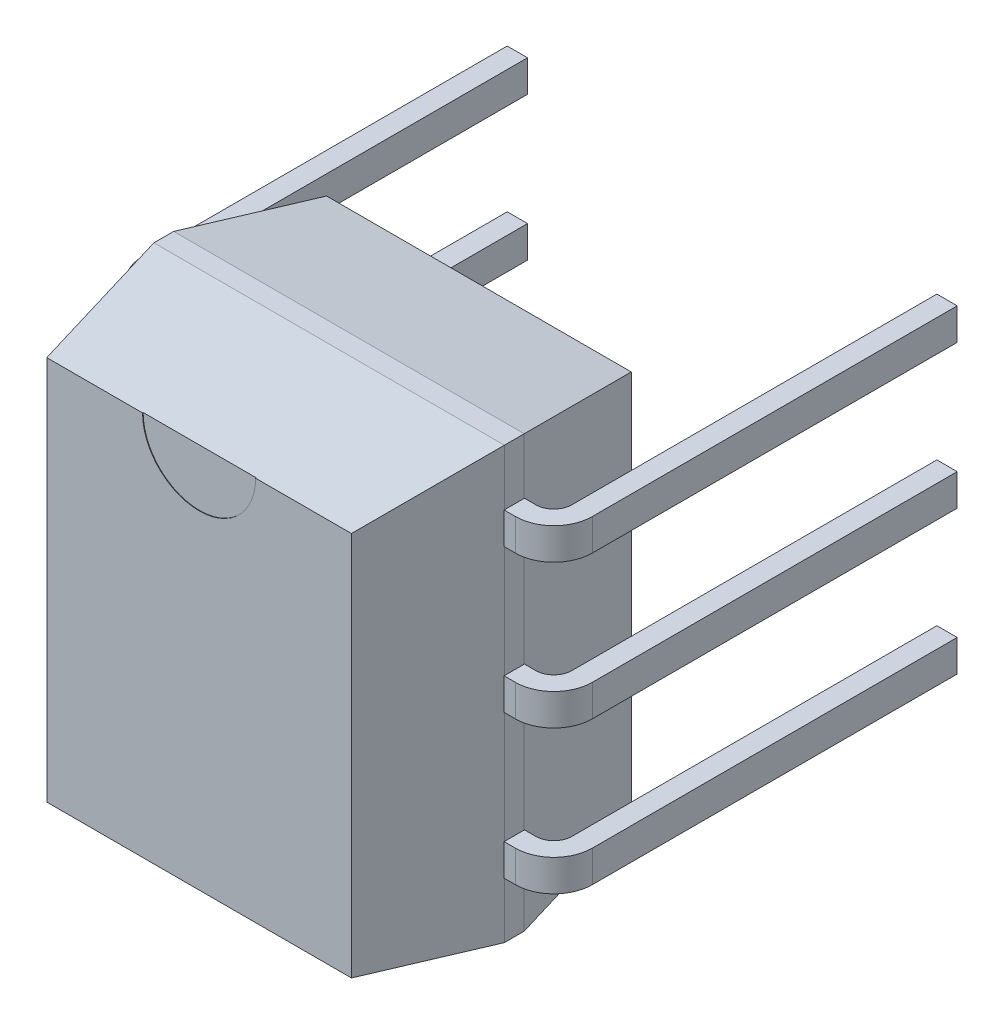
from build123d import *

# Parameters (mm, degrees)
EXTRUDE_1_DEPTH     = 4.95
SKETCH_5_W          = 0.36
SKETCH_5_H          = 0.56
SKETCH_5_2_W        = 0.36
SKETCH_5_2_H        = 0.56
EXTRUDE_2_DEPTH     = 4.1
CHAMFER_1_SIZE      = 2.3
CHAMFER_1_SIZE_2    = 0.405552056
SKETCH_6_R          = 1
CUT_EXTRUDE_1_DEPTH = 0.01
SKETCH_7_W          = 10.556189846
SKETCH_7_H          = 3.652287582
CUT_EXTRUDE_2_DEPTH = 20
CHAMFER_2_SIZE      = 2.3
CHAMFER_2_SIZE2     = 0.405552056
SKETCH_8_R          = 0.119462925
CUT_EXTRUDE_3_DEPTH = 2


with BuildPart() as part:
    # Эскиз3 → Вытянуть1 (new body)
    with BuildSketch(Plane.XY.offset(5.33)):
        Polygon((0.7, 1.27), (3.8, 1.27), (6.9, 1.27), (6.9, -8.89), (0.7, -8.89), align=None)
    extrude(amount=-EXTRUDE_1_DEPTH)

    # По траектории1: sweep along a path in Эскиз4
    with BuildLine(Plane(origin=(0, 0, 0), x_dir=(1, 0, 0), z_dir=(0, 1, 0))) as sweep_1_path:
        Line((0, 0), (0, -2.355))
        ThreePointArc((0, -2.355), (0.146446609, -2.708553391), (0.5, -2.855))
        Line((0.5, -2.855), (0.7, -2.855))
        Line((0.7, -2.855), (6.9, -2.855))
        Line((6.9, -2.855), (7.1, -2.855))
        ThreePointArc((7.1, -2.855), (7.453553391, -2.708553391), (7.6, -2.355))
        Line((7.6, -2.355), (7.6, 0))
        Line((7.6, 0), (7.6, 4.1))
    # Эскиз5 → По траектории1 (sweep)
    with BuildSketch(Plane.XY):
        with Locations((0, -2.54)):
            Rectangle(SKETCH_5_W, SKETCH_5_H)
        Rectangle(SKETCH_5_W, SKETCH_5_H)
        with Locations((0, -5.08)):
            Rectangle(SKETCH_5_W, SKETCH_5_H)
        with Locations((0, -7.62)):
            Rectangle(SKETCH_5_W, SKETCH_5_H)
    sweep(path=sweep_1_path.line)

    # Эскиз5<2> → Вытянуть2 (add)
    with BuildSketch(Plane.XY):
        with Locations((0, -2.54)):
            Rectangle(SKETCH_5_2_W, SKETCH_5_2_H)
        Rectangle(SKETCH_5_2_W, SKETCH_5_2_H)
        with Locations((0, -5.08)):
            Rectangle(SKETCH_5_2_W, SKETCH_5_2_H)
        with Locations((0, -7.62)):
            Rectangle(SKETCH_5_2_W, SKETCH_5_2_H)
    extrude(amount=-EXTRUDE_2_DEPTH)

    # Фаска1
    # the kernel refuses this chamfer: 2.3, 0.405552056 mm, written as the material it takes off along each edge
    with BuildSketch(Plane(origin=(12.876639232, -8.89, 0.38), x_dir=(0, -0.006682531656101655, 0.9999776716360548), z_dir=(-1, 0, 0))) as chamfer_1_piece_1:
        Polygon((CHAMFER_1_SIZE * 0.999977671636, CHAMFER_1_SIZE * 0.0066825316561), (-CHAMFER_1_SIZE_2 * 0.00668253165, CHAMFER_1_SIZE_2 * 0.999977670722), (0, 0), align=None)
    extrude(amount=18.153278464, mode=Mode.SUBTRACT)
    with BuildSketch(Plane(origin=(12.876639232, -8.89, 5.33), x_dir=(0, 0.9776715712462588, 0.2101387607674306), z_dir=(-1, 0, 0))) as chamfer_1_piece_2:
        Polygon((CHAMFER_1_SIZE_2 * 0.977671570353, CHAMFER_1_SIZE_2 * 0.210138760575), (-CHAMFER_1_SIZE * 0.210138760767, CHAMFER_1_SIZE * 0.977671571246), (0, 0), align=None)
    extrude(amount=18.153278464, mode=Mode.SUBTRACT)
    with BuildSketch(Plane(origin=(6.9, 7.246639232, 0.38), x_dir=(0.006682531656101655, 0, 0.9999776716360548), z_dir=(0, -1, 0))) as chamfer_1_piece_3_section:
        Polygon((CHAMFER_1_SIZE * 0.999977671636, CHAMFER_1_SIZE * 0.0066825316561), (-CHAMFER_1_SIZE_2 * 0.00668253165, CHAMFER_1_SIZE_2 * 0.999977670722), (0, 0), align=None)
    chamfer_1_piece_3 = extrude(amount=22.113278464, mode=Mode.PRIVATE)
    chamfer_1_piece_3 = split(chamfer_1_piece_3, bisect_by=Plane(origin=(6.899706122, 0.28, 2.676666667), z_dir=(0, 1, 0)), keep=Keep.TOP, mode=Mode.PRIVATE)
    add(chamfer_1_piece_3, mode=Mode.SUBTRACT)
    with BuildSketch(Plane(origin=(6.9, 7.246639232, 0.38), x_dir=(0.006682531656101655, 0, 0.9999776716360548), z_dir=(0, -1, 0))) as chamfer_1_piece_4_section:
        Polygon((CHAMFER_1_SIZE * 0.999977671636, CHAMFER_1_SIZE * 0.0066825316561), (-CHAMFER_1_SIZE_2 * 0.00668253165, CHAMFER_1_SIZE_2 * 0.999977670722), (0, 0), align=None)
    chamfer_1_piece_4 = extrude(amount=22.113278464, mode=Mode.PRIVATE)
    chamfer_1_piece_4 = split(chamfer_1_piece_4, bisect_by=Plane(origin=(6.764815344, 0, 2.675), z_dir=(0, 0, -1)), keep=Keep.TOP, mode=Mode.PRIVATE)
    add(chamfer_1_piece_4, mode=Mode.SUBTRACT)
    with BuildSketch(Plane(origin=(6.9, 7.246639232, 0.38), x_dir=(0.006682531656101655, 0, 0.9999776716360548), z_dir=(0, -1, 0))) as chamfer_1_piece_5_section:
        Polygon((CHAMFER_1_SIZE * 0.999977671636, CHAMFER_1_SIZE * 0.0066825316561), (-CHAMFER_1_SIZE_2 * 0.00668253165, CHAMFER_1_SIZE_2 * 0.999977670722), (0, 0), align=None)
    chamfer_1_piece_5 = extrude(amount=22.113278464, mode=Mode.PRIVATE)
    chamfer_1_piece_5 = split(chamfer_1_piece_5, bisect_by=Plane(origin=(6.899706122, -2.26, 2.676666667), z_dir=(0, 1, 0)), keep=Keep.TOP, mode=Mode.PRIVATE)
    chamfer_1_piece_5 = split(chamfer_1_piece_5, bisect_by=Plane(origin=(6.899706122, -0.28, 2.676666667), z_dir=(0, -1, 0)), keep=Keep.TOP, mode=Mode.PRIVATE)
    add(chamfer_1_piece_5, mode=Mode.SUBTRACT)
    with BuildSketch(Plane(origin=(6.9, 7.246639232, 0.38), x_dir=(0.006682531656101655, 0, 0.9999776716360548), z_dir=(0, -1, 0))) as chamfer_1_piece_6_section:
        Polygon((CHAMFER_1_SIZE * 0.999977671636, CHAMFER_1_SIZE * 0.0066825316561), (-CHAMFER_1_SIZE_2 * 0.00668253165, CHAMFER_1_SIZE_2 * 0.999977670722), (0, 0), align=None)
    chamfer_1_piece_6 = extrude(amount=22.113278464, mode=Mode.PRIVATE)
    chamfer_1_piece_6 = split(chamfer_1_piece_6, bisect_by=Plane(origin=(6.899706122, -2.82, 2.676666667), z_dir=(0, -1, 0)), keep=Keep.TOP, mode=Mode.PRIVATE)
    chamfer_1_piece_6 = split(chamfer_1_piece_6, bisect_by=Plane(origin=(6.899706122, -4.8, 2.676666667), z_dir=(0, 1, 0)), keep=Keep.TOP, mode=Mode.PRIVATE)
    add(chamfer_1_piece_6, mode=Mode.SUBTRACT)
    with BuildSketch(Plane(origin=(6.9, 7.246639232, 0.38), x_dir=(0.006682531656101655, 0, 0.9999776716360548), z_dir=(0, -1, 0))) as chamfer_1_piece_7_section:
        Polygon((CHAMFER_1_SIZE * 0.999977671636, CHAMFER_1_SIZE * 0.0066825316561), (-CHAMFER_1_SIZE_2 * 0.00668253165, CHAMFER_1_SIZE_2 * 0.999977670722), (0, 0), align=None)
    chamfer_1_piece_7 = extrude(amount=22.113278464, mode=Mode.PRIVATE)
    chamfer_1_piece_7 = split(chamfer_1_piece_7, bisect_by=Plane(origin=(6.899706122, -7.34, 2.676666667), z_dir=(0, 1, 0)), keep=Keep.TOP, mode=Mode.PRIVATE)
    chamfer_1_piece_7 = split(chamfer_1_piece_7, bisect_by=Plane(origin=(6.899706122, -5.36, 2.676666667), z_dir=(0, -1, 0)), keep=Keep.TOP, mode=Mode.PRIVATE)
    add(chamfer_1_piece_7, mode=Mode.SUBTRACT)
    with BuildSketch(Plane(origin=(6.9, 7.246639232, 0.38), x_dir=(0.006682531656101655, 0, 0.9999776716360548), z_dir=(0, -1, 0))) as chamfer_1_piece_8_section:
        Polygon((CHAMFER_1_SIZE * 0.999977671636, CHAMFER_1_SIZE * 0.0066825316561), (-CHAMFER_1_SIZE_2 * 0.00668253165, CHAMFER_1_SIZE_2 * 0.999977670722), (0, 0), align=None)
    chamfer_1_piece_8 = extrude(amount=22.113278464, mode=Mode.PRIVATE)
    chamfer_1_piece_8 = split(chamfer_1_piece_8, bisect_by=Plane(origin=(6.899706122, -7.9, 2.676666667), z_dir=(0, -1, 0)), keep=Keep.TOP, mode=Mode.PRIVATE)
    add(chamfer_1_piece_8, mode=Mode.SUBTRACT)
    with BuildSketch(Plane(origin=(6.9, 7.246639232, 5.33), x_dir=(-0.9776715712462587, 0, 0.21013876076743102), z_dir=(0, -1, 0))) as chamfer_1_piece_9_section:
        Polygon((CHAMFER_1_SIZE_2 * 0.977671570353, CHAMFER_1_SIZE_2 * 0.210138760575), (-CHAMFER_1_SIZE * 0.210138760767, CHAMFER_1_SIZE * 0.977671571246), (0, 0), align=None)
    chamfer_1_piece_9 = extrude(amount=22.113278464, mode=Mode.PRIVATE)
    chamfer_1_piece_9 = split(chamfer_1_piece_9, bisect_by=Plane(origin=(6.764815344, 0.775, 3.035), z_dir=(0, 0, 1)), keep=Keep.TOP, mode=Mode.PRIVATE)
    add(chamfer_1_piece_9, mode=Mode.SUBTRACT)
    with BuildSketch(Plane(origin=(6.9, 7.246639232, 5.33), x_dir=(-0.9776715712462587, 0, 0.21013876076743102), z_dir=(0, -1, 0))) as chamfer_1_piece_10_section:
        Polygon((CHAMFER_1_SIZE_2 * 0.977671570353, CHAMFER_1_SIZE_2 * 0.210138760575), (-CHAMFER_1_SIZE * 0.210138760767, CHAMFER_1_SIZE * 0.977671571246), (0, 0), align=None)
    chamfer_1_piece_10 = extrude(amount=22.113278464, mode=Mode.PRIVATE)
    chamfer_1_piece_10 = split(chamfer_1_piece_10, bisect_by=Plane(origin=(6.899706122, 0.28, 3.033333333), z_dir=(0, 1, 0)), keep=Keep.TOP, mode=Mode.PRIVATE)
    add(chamfer_1_piece_10, mode=Mode.SUBTRACT)
    with BuildSketch(Plane(origin=(6.9, 7.246639232, 5.33), x_dir=(-0.9776715712462587, 0, 0.21013876076743102), z_dir=(0, -1, 0))) as chamfer_1_piece_11_section:
        Polygon((CHAMFER_1_SIZE_2 * 0.977671570353, CHAMFER_1_SIZE_2 * 0.210138760575), (-CHAMFER_1_SIZE * 0.210138760767, CHAMFER_1_SIZE * 0.977671571246), (0, 0), align=None)
    chamfer_1_piece_11 = extrude(amount=22.113278464, mode=Mode.PRIVATE)
    chamfer_1_piece_11 = split(chamfer_1_piece_11, bisect_by=Plane(origin=(6.899706122, -2.26, 3.033333333), z_dir=(0, 1, 0)), keep=Keep.TOP, mode=Mode.PRIVATE)
    chamfer_1_piece_11 = split(chamfer_1_piece_11, bisect_by=Plane(origin=(6.899706122, -0.28, 3.033333333), z_dir=(0, -1, 0)), keep=Keep.TOP, mode=Mode.PRIVATE)
    add(chamfer_1_piece_11, mode=Mode.SUBTRACT)
    with BuildSketch(Plane(origin=(6.9, 7.246639232, 5.33), x_dir=(-0.9776715712462587, 0, 0.21013876076743102), z_dir=(0, -1, 0))) as chamfer_1_piece_12_section:
        Polygon((CHAMFER_1_SIZE_2 * 0.977671570353, CHAMFER_1_SIZE_2 * 0.210138760575), (-CHAMFER_1_SIZE * 0.210138760767, CHAMFER_1_SIZE * 0.977671571246), (0, 0), align=None)
    chamfer_1_piece_12 = extrude(amount=22.113278464, mode=Mode.PRIVATE)
    chamfer_1_piece_12 = split(chamfer_1_piece_12, bisect_by=Plane(origin=(6.899706122, -2.82, 3.033333333), z_dir=(0, -1, 0)), keep=Keep.TOP, mode=Mode.PRIVATE)
    chamfer_1_piece_12 = split(chamfer_1_piece_12, bisect_by=Plane(origin=(6.899706122, -4.8, 3.033333333), z_dir=(0, 1, 0)), keep=Keep.TOP, mode=Mode.PRIVATE)
    add(chamfer_1_piece_12, mode=Mode.SUBTRACT)
    with BuildSketch(Plane(origin=(6.9, 7.246639232, 5.33), x_dir=(-0.9776715712462587, 0, 0.21013876076743102), z_dir=(0, -1, 0))) as chamfer_1_piece_13_section:
        Polygon((CHAMFER_1_SIZE_2 * 0.977671570353, CHAMFER_1_SIZE_2 * 0.210138760575), (-CHAMFER_1_SIZE * 0.210138760767, CHAMFER_1_SIZE * 0.977671571246), (0, 0), align=None)
    chamfer_1_piece_13 = extrude(amount=22.113278464, mode=Mode.PRIVATE)
    chamfer_1_piece_13 = split(chamfer_1_piece_13, bisect_by=Plane(origin=(6.899706122, -7.34, 3.033333333), z_dir=(0, 1, 0)), keep=Keep.TOP, mode=Mode.PRIVATE)
    chamfer_1_piece_13 = split(chamfer_1_piece_13, bisect_by=Plane(origin=(6.899706122, -5.36, 3.033333333), z_dir=(0, -1, 0)), keep=Keep.TOP, mode=Mode.PRIVATE)
    add(chamfer_1_piece_13, mode=Mode.SUBTRACT)
    with BuildSketch(Plane(origin=(6.9, 7.246639232, 5.33), x_dir=(-0.9776715712462587, 0, 0.21013876076743102), z_dir=(0, -1, 0))) as chamfer_1_piece_14_section:
        Polygon((CHAMFER_1_SIZE_2 * 0.977671570353, CHAMFER_1_SIZE_2 * 0.210138760575), (-CHAMFER_1_SIZE * 0.210138760767, CHAMFER_1_SIZE * 0.977671571246), (0, 0), align=None)
    chamfer_1_piece_14 = extrude(amount=22.113278464, mode=Mode.PRIVATE)
    chamfer_1_piece_14 = split(chamfer_1_piece_14, bisect_by=Plane(origin=(6.899706122, -7.9, 3.033333333), z_dir=(0, -1, 0)), keep=Keep.TOP, mode=Mode.PRIVATE)
    add(chamfer_1_piece_14, mode=Mode.SUBTRACT)
    with BuildSketch(Plane(origin=(12.876639232, 1.27, 0.38), x_dir=(0, 0.006682531656101748, 0.9999776716360548), z_dir=(-1, 0, 0)), Plane(origin=(-5.276639232, 1.27, 5.33), x_dir=(0, 0.006682531656101748, -0.9999776716360548), z_dir=(1, 0, 0))) as chamfer_1_piece_15:
        Polygon((CHAMFER_1_SIZE * 0.999977671636, -CHAMFER_1_SIZE * 0.0066825316561), (-CHAMFER_1_SIZE_2 * 0.00668253165, -CHAMFER_1_SIZE_2 * 0.999977670722), (0, 0), align=None)
    extrude(amount=18.153278464, mode=Mode.SUBTRACT)
    with BuildSketch(Plane(origin=(0.7, -14.866639232, 0.38), x_dir=(0.9776715712462587, 0, -0.2101387607674313), z_dir=(0, 1, 0))) as chamfer_1_piece_16_section:
        Polygon((CHAMFER_1_SIZE_2 * 0.977671570353, -CHAMFER_1_SIZE_2 * 0.210138760575), (-CHAMFER_1_SIZE * 0.210138760767, -CHAMFER_1_SIZE * 0.977671571246), (0, 0), align=None)
    chamfer_1_piece_16 = extrude(amount=22.113278464, mode=Mode.PRIVATE)
    chamfer_1_piece_16 = split(chamfer_1_piece_16, bisect_by=Plane(origin=(0.835184656, -8.395, 2.675), z_dir=(0, 0, -1)), keep=Keep.TOP, mode=Mode.PRIVATE)
    add(chamfer_1_piece_16, mode=Mode.SUBTRACT)
    with BuildSketch(Plane(origin=(0.7, -14.866639232, 0.38), x_dir=(0.9776715712462587, 0, -0.2101387607674313), z_dir=(0, 1, 0))) as chamfer_1_piece_17_section:
        Polygon((CHAMFER_1_SIZE_2 * 0.977671570353, -CHAMFER_1_SIZE_2 * 0.210138760575), (-CHAMFER_1_SIZE * 0.210138760767, -CHAMFER_1_SIZE * 0.977671571246), (0, 0), align=None)
    chamfer_1_piece_17 = extrude(amount=22.113278464, mode=Mode.PRIVATE)
    chamfer_1_piece_17 = split(chamfer_1_piece_17, bisect_by=Plane(origin=(0.700293878, -7.9, 2.676666667), z_dir=(0, -1, 0)), keep=Keep.TOP, mode=Mode.PRIVATE)
    add(chamfer_1_piece_17, mode=Mode.SUBTRACT)
    with BuildSketch(Plane(origin=(0.7, -14.866639232, 0.38), x_dir=(0.9776715712462587, 0, -0.2101387607674313), z_dir=(0, 1, 0))) as chamfer_1_piece_18_section:
        Polygon((CHAMFER_1_SIZE_2 * 0.977671570353, -CHAMFER_1_SIZE_2 * 0.210138760575), (-CHAMFER_1_SIZE * 0.210138760767, -CHAMFER_1_SIZE * 0.977671571246), (0, 0), align=None)
    chamfer_1_piece_18 = extrude(amount=22.113278464, mode=Mode.PRIVATE)
    chamfer_1_piece_18 = split(chamfer_1_piece_18, bisect_by=Plane(origin=(0.700293878, -5.36, 2.676666667), z_dir=(0, -1, 0)), keep=Keep.TOP, mode=Mode.PRIVATE)
    chamfer_1_piece_18 = split(chamfer_1_piece_18, bisect_by=Plane(origin=(0.700293878, -7.34, 2.676666667), z_dir=(0, 1, 0)), keep=Keep.TOP, mode=Mode.PRIVATE)
    add(chamfer_1_piece_18, mode=Mode.SUBTRACT)
    with BuildSketch(Plane(origin=(0.7, -14.866639232, 0.38), x_dir=(0.9776715712462587, 0, -0.2101387607674313), z_dir=(0, 1, 0))) as chamfer_1_piece_19_section:
        Polygon((CHAMFER_1_SIZE_2 * 0.977671570353, -CHAMFER_1_SIZE_2 * 0.210138760575), (-CHAMFER_1_SIZE * 0.210138760767, -CHAMFER_1_SIZE * 0.977671571246), (0, 0), align=None)
    chamfer_1_piece_19 = extrude(amount=22.113278464, mode=Mode.PRIVATE)
    chamfer_1_piece_19 = split(chamfer_1_piece_19, bisect_by=Plane(origin=(0.700293878, -2.82, 2.676666667), z_dir=(0, -1, 0)), keep=Keep.TOP, mode=Mode.PRIVATE)
    chamfer_1_piece_19 = split(chamfer_1_piece_19, bisect_by=Plane(origin=(0.700293878, -4.8, 2.676666667), z_dir=(0, 1, 0)), keep=Keep.TOP, mode=Mode.PRIVATE)
    add(chamfer_1_piece_19, mode=Mode.SUBTRACT)
    with BuildSketch(Plane(origin=(0.7, -14.866639232, 0.38), x_dir=(0.9776715712462587, 0, -0.2101387607674313), z_dir=(0, 1, 0))) as chamfer_1_piece_20_section:
        Polygon((CHAMFER_1_SIZE_2 * 0.977671570353, -CHAMFER_1_SIZE_2 * 0.210138760575), (-CHAMFER_1_SIZE * 0.210138760767, -CHAMFER_1_SIZE * 0.977671571246), (0, 0), align=None)
    chamfer_1_piece_20 = extrude(amount=22.113278464, mode=Mode.PRIVATE)
    chamfer_1_piece_20 = split(chamfer_1_piece_20, bisect_by=Plane(origin=(0.700293878, -0.28, 2.676666667), z_dir=(0, -1, 0)), keep=Keep.TOP, mode=Mode.PRIVATE)
    chamfer_1_piece_20 = split(chamfer_1_piece_20, bisect_by=Plane(origin=(0.700293878, -2.26, 2.676666667), z_dir=(0, 1, 0)), keep=Keep.TOP, mode=Mode.PRIVATE)
    add(chamfer_1_piece_20, mode=Mode.SUBTRACT)
    with BuildSketch(Plane(origin=(0.7, -14.866639232, 0.38), x_dir=(0.9776715712462587, 0, -0.2101387607674313), z_dir=(0, 1, 0))) as chamfer_1_piece_21_section:
        Polygon((CHAMFER_1_SIZE_2 * 0.977671570353, -CHAMFER_1_SIZE_2 * 0.210138760575), (-CHAMFER_1_SIZE * 0.210138760767, -CHAMFER_1_SIZE * 0.977671571246), (0, 0), align=None)
    chamfer_1_piece_21 = extrude(amount=22.113278464, mode=Mode.PRIVATE)
    chamfer_1_piece_21 = split(chamfer_1_piece_21, bisect_by=Plane(origin=(0.700293878, 0.28, 2.676666667), z_dir=(0, 1, 0)), keep=Keep.TOP, mode=Mode.PRIVATE)
    add(chamfer_1_piece_21, mode=Mode.SUBTRACT)
    with BuildSketch(Plane(origin=(0.7, -14.866639232, 5.33), x_dir=(0.9776715712462587, 0, 0.2101387607674309), z_dir=(0, 1, 0))) as chamfer_1_piece_22_section:
        Polygon((CHAMFER_1_SIZE_2 * 0.977671570353, CHAMFER_1_SIZE_2 * 0.210138760575), (-CHAMFER_1_SIZE * 0.210138760767, CHAMFER_1_SIZE * 0.977671571246), (0, 0), align=None)
    chamfer_1_piece_22 = extrude(amount=22.113278464, mode=Mode.PRIVATE)
    chamfer_1_piece_22 = split(chamfer_1_piece_22, bisect_by=Plane(origin=(0.835184656, -8.395, 3.035), z_dir=(0, 0, 1)), keep=Keep.TOP, mode=Mode.PRIVATE)
    add(chamfer_1_piece_22, mode=Mode.SUBTRACT)
    with BuildSketch(Plane(origin=(0.7, -14.866639232, 5.33), x_dir=(0.9776715712462587, 0, 0.2101387607674309), z_dir=(0, 1, 0))) as chamfer_1_piece_23_section:
        Polygon((CHAMFER_1_SIZE_2 * 0.977671570353, CHAMFER_1_SIZE_2 * 0.210138760575), (-CHAMFER_1_SIZE * 0.210138760767, CHAMFER_1_SIZE * 0.977671571246), (0, 0), align=None)
    chamfer_1_piece_23 = extrude(amount=22.113278464, mode=Mode.PRIVATE)
    chamfer_1_piece_23 = split(chamfer_1_piece_23, bisect_by=Plane(origin=(0.700293878, -7.9, 3.033333333), z_dir=(0, -1, 0)), keep=Keep.TOP, mode=Mode.PRIVATE)
    add(chamfer_1_piece_23, mode=Mode.SUBTRACT)
    with BuildSketch(Plane(origin=(0.7, -14.866639232, 5.33), x_dir=(0.9776715712462587, 0, 0.2101387607674309), z_dir=(0, 1, 0))) as chamfer_1_piece_24_section:
        Polygon((CHAMFER_1_SIZE_2 * 0.977671570353, CHAMFER_1_SIZE_2 * 0.210138760575), (-CHAMFER_1_SIZE * 0.210138760767, CHAMFER_1_SIZE * 0.977671571246), (0, 0), align=None)
    chamfer_1_piece_24 = extrude(amount=22.113278464, mode=Mode.PRIVATE)
    chamfer_1_piece_24 = split(chamfer_1_piece_24, bisect_by=Plane(origin=(0.700293878, -5.36, 3.033333333), z_dir=(0, -1, 0)), keep=Keep.TOP, mode=Mode.PRIVATE)
    chamfer_1_piece_24 = split(chamfer_1_piece_24, bisect_by=Plane(origin=(0.700293878, -7.34, 3.033333333), z_dir=(0, 1, 0)), keep=Keep.TOP, mode=Mode.PRIVATE)
    add(chamfer_1_piece_24, mode=Mode.SUBTRACT)
    with BuildSketch(Plane(origin=(0.7, -14.866639232, 5.33), x_dir=(0.9776715712462587, 0, 0.2101387607674309), z_dir=(0, 1, 0))) as chamfer_1_piece_25_section:
        Polygon((CHAMFER_1_SIZE_2 * 0.977671570353, CHAMFER_1_SIZE_2 * 0.210138760575), (-CHAMFER_1_SIZE * 0.210138760767, CHAMFER_1_SIZE * 0.977671571246), (0, 0), align=None)
    chamfer_1_piece_25 = extrude(amount=22.113278464, mode=Mode.PRIVATE)
    chamfer_1_piece_25 = split(chamfer_1_piece_25, bisect_by=Plane(origin=(0.700293878, -2.82, 3.033333333), z_dir=(0, -1, 0)), keep=Keep.TOP, mode=Mode.PRIVATE)
    chamfer_1_piece_25 = split(chamfer_1_piece_25, bisect_by=Plane(origin=(0.700293878, -4.8, 3.033333333), z_dir=(0, 1, 0)), keep=Keep.TOP, mode=Mode.PRIVATE)
    add(chamfer_1_piece_25, mode=Mode.SUBTRACT)
    with BuildSketch(Plane(origin=(0.7, -14.866639232, 5.33), x_dir=(0.9776715712462587, 0, 0.2101387607674309), z_dir=(0, 1, 0))) as chamfer_1_piece_26_section:
        Polygon((CHAMFER_1_SIZE_2 * 0.977671570353, CHAMFER_1_SIZE_2 * 0.210138760575), (-CHAMFER_1_SIZE * 0.210138760767, CHAMFER_1_SIZE * 0.977671571246), (0, 0), align=None)
    chamfer_1_piece_26 = extrude(amount=22.113278464, mode=Mode.PRIVATE)
    chamfer_1_piece_26 = split(chamfer_1_piece_26, bisect_by=Plane(origin=(0.700293878, -0.28, 3.033333333), z_dir=(0, -1, 0)), keep=Keep.TOP, mode=Mode.PRIVATE)
    chamfer_1_piece_26 = split(chamfer_1_piece_26, bisect_by=Plane(origin=(0.700293878, -2.26, 3.033333333), z_dir=(0, 1, 0)), keep=Keep.TOP, mode=Mode.PRIVATE)
    add(chamfer_1_piece_26, mode=Mode.SUBTRACT)
    with BuildSketch(Plane(origin=(0.7, -14.866639232, 5.33), x_dir=(0.9776715712462587, 0, 0.2101387607674309), z_dir=(0, 1, 0))) as chamfer_1_piece_27_section:
        Polygon((CHAMFER_1_SIZE_2 * 0.977671570353, CHAMFER_1_SIZE_2 * 0.210138760575), (-CHAMFER_1_SIZE * 0.210138760767, CHAMFER_1_SIZE * 0.977671571246), (0, 0), align=None)
    chamfer_1_piece_27 = extrude(amount=22.113278464, mode=Mode.PRIVATE)
    chamfer_1_piece_27 = split(chamfer_1_piece_27, bisect_by=Plane(origin=(0.700293878, 0.28, 3.033333333), z_dir=(0, 1, 0)), keep=Keep.TOP, mode=Mode.PRIVATE)
    add(chamfer_1_piece_27, mode=Mode.SUBTRACT)

    # Эскиз6 → Вырез-Вытянуть1 (cut)
    with BuildSketch(Plane.XY.offset(5.33)):
        with Locations((3.8, 0.864447944)):
            Circle(SKETCH_6_R)
    extrude(amount=-CUT_EXTRUDE_1_DEPTH, mode=Mode.SUBTRACT)

    # Эскиз7 → Вырез-Вытянуть2 (cut)
    with BuildSketch(Plane.XY.offset(5.33)):
        with Locations((4.103600287, -8.176143791)):
            Rectangle(SKETCH_7_W, SKETCH_7_H)
    extrude(amount=-CUT_EXTRUDE_2_DEPTH, mode=Mode.SUBTRACT)

    # Фаска2
    chamfer_2_edges = [part.edges().sort_by_distance(p)[0] for p in [
        (3.8, -6.35, 0.38),
        (3.8, -6.35, 5.33),
    ]]
    chamfer_2_side = [part.faces().sort_by_distance(p)[0] for p in [
        (3.8, -6.35, 2.855),
    ]]
    chamfer(chamfer_2_edges, length=CHAMFER_2_SIZE, length2=CHAMFER_2_SIZE2, reference=chamfer_2_side[0])

    # Эскиз8 → Вырез-Вытянуть3 (cut)
    with BuildSketch(Plane(origin=(0, 0, -4.1), x_dir=(-1, 0, 0), z_dir=(0, 0, -1))):
        Circle(SKETCH_8_R)
    extrude(amount=-CUT_EXTRUDE_3_DEPTH, mode=Mode.SUBTRACT)


solid = part.part
